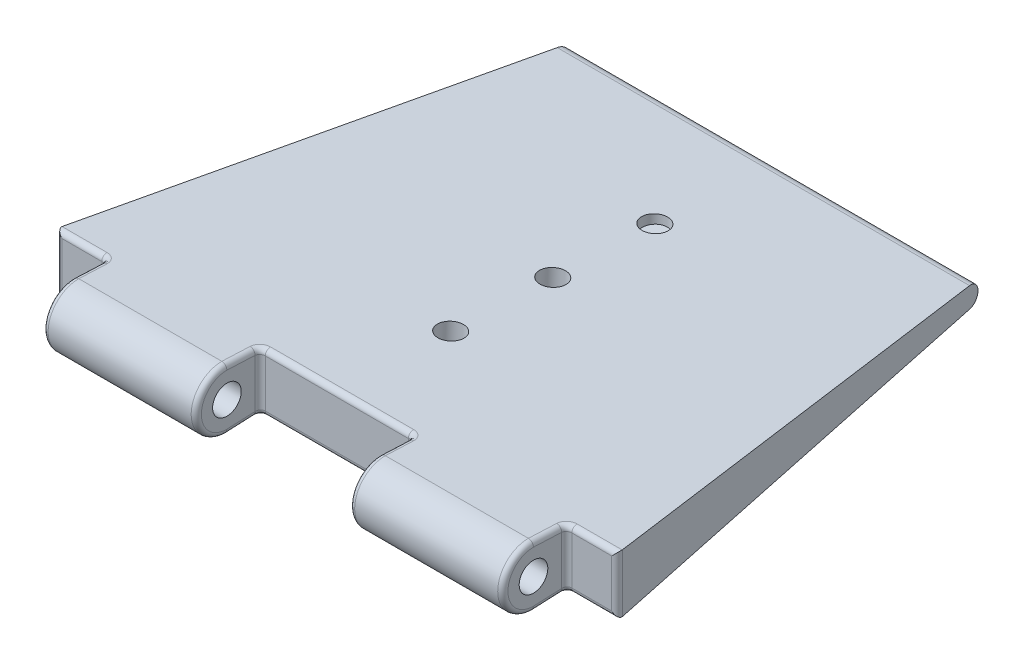
from build123d import *

# Parameters (mm, degrees)
SKETCH1_R                        = 1.4
BOSS_EXTRUDE1_DEPTH              = 55
CUT_EXTRUDE1_DEPTH               = 72.763500472
CUT_EXTRUDE1_DEPTH_BACK          = 72.763500472
SKETCH2_W                        = 15
SKETCH2_H                        = 6.5
CUT_EXTRUDE2_DEPTH               = 72.763500472
CUT_EXTRUDE2_DEPTH_BACK          = 72.763500472
FILLET3_R                        = 0.5
CUT_EXTRUDE3_REACH               = 75.793
CUT_EXTRUDE3_OFFSET_FROM_SURFACE = 2
SKETCH5_R                        = 1.25


with BuildPart() as part:
    # Sketch1 → Boss-Extrude1 (new body)
    with BuildSketch(Plane(origin=(0, 0, 0), x_dir=(0, 0, -1), z_dir=(1, 0, 0))):
        with BuildLine():
            Line((0.266140956, 2.988171513), (0, 3))
            ThreePointArc((0, 3), (-3, 0), (0, -3))
            Line((0, -3), (0.266140956, -2.988171513))
            Line((0.266140956, -2.988171513), (45, -1))
            ThreePointArc((45, -1), (46, 0), (45, 1))
            Line((45, 1), (0.266140956, 2.988171513))
        make_face()
        Circle(SKETCH1_R, mode=Mode.SUBTRACT)
    extrude(amount=BOSS_EXTRUDE1_DEPTH)

    # Sketch2 → Cut-Extrude1 (cut, two sides: drawn at the far end of the back side and taken through both)
    with BuildSketch(Plane(origin=(0, 0, 0), x_dir=(1, 0, 0), z_dir=(0, 1, 0)).offset(-CUT_EXTRUDE1_DEPTH_BACK)):
        with Locations((57.5, 0)):
            Rectangle(SKETCH2_W, SKETCH2_H)
        with Locations((27.5, 0)):
            Rectangle(SKETCH2_W, SKETCH2_H)
        with Locations((-2.5, 0)):
            Rectangle(SKETCH2_W, SKETCH2_H)
    extrude(amount=CUT_EXTRUDE1_DEPTH + CUT_EXTRUDE1_DEPTH_BACK, mode=Mode.SUBTRACT)

    # Sketch3 → Cut-Extrude2 (cut, two sides: drawn at the far end of the back side and taken through both)
    with BuildSketch(Plane(origin=(0, 0, 0), x_dir=(1, 0, 0), z_dir=(0, 1, 0)).offset(-CUT_EXTRUDE2_DEPTH_BACK)):
        Polygon((55, 3.25), (47.5, 46), (55, 46), align=None)
        Polygon((7.5, 46), (0, 46), (0, 3.25), align=None)
    extrude(amount=CUT_EXTRUDE2_DEPTH + CUT_EXTRUDE2_DEPTH_BACK, mode=Mode.SUBTRACT)

    # Fillet3
    fillet3_edges = [part.edges().sort_by_distance(p)[0] for p in [
        (50, -2.927777778, -1.625),
        (50, 2.927777778, -1.625),
        (5, 2.927777778, -1.625),
        (5, -2.927777778, -1.625),
        (20, -2.927777778, -1.625),
        (20, 2.927777778, -1.625),
        (35, 2.927777778, -1.625),
        (35, -2.927777778, -1.625),
        (50, 0, -3.25),
        (52.5, 2.855555556, -3.25),
        (55, 0, -3.25),
        (52.5, -2.855555556, -3.25),
        (0, 0, -3.25),
        (2.5, 2.855555556, -3.25),
        (5, 0, -3.25),
        (2.5, -2.855555556, -3.25),
        (20, 0, -3.25),
        (27.5, 2.855555556, -3.25),
        (35, 0, -3.25),
        (27.5, -2.855555556, -3.25),
        (5, 0, 3),
        (20, 0, 3),
        (35, 0, 3),
        (50, 0, 3),
    ]]
    fillet(fillet3_edges, radius=FILLET3_R)

    # Cut-Extrude3: up to this face of the body (flat: up to its plane, moved by the offset)
    cut_extrude3_end = Plane(part.part.faces().sort_by_distance((27.5, -2.01165646, -22.237729641))[0]).offset(-CUT_EXTRUDE3_OFFSET_FROM_SURFACE)
    # Sketch5 → Cut-Extrude3 (cut, up to the picked face)
    with BuildSketch(Plane(origin=(0, 2.994085757, -0.133070478), x_dir=(1, 0, 0), z_dir=(0, 0.9990138064662089, -0.0444006136207204)), mode=Mode.PRIVATE) as cut_extrude3_sk1:
        with Locations((27.5, 24.276971468)):
            Circle(SKETCH5_R)
    cut_extrude3_tool1 = split(extrude(cut_extrude3_sk1.sketch, amount=-CUT_EXTRUDE3_REACH, mode=Mode.PRIVATE), bisect_by=cut_extrude3_end, keep=Keep.BOTH, mode=Mode.PRIVATE)
    # Sketch5 → Cut-Extrude3 (cut, up to the picked face)
    with BuildSketch(Plane(origin=(0, 2.994085757, -0.133070478), x_dir=(1, 0, 0), z_dir=(0, 0.9990138064662089, -0.0444006136207204)), mode=Mode.PRIVATE) as cut_extrude3_sk2:
        with Locations((27.5, 14.276971468)):
            Circle(SKETCH5_R)
    cut_extrude3_tool2 = split(extrude(cut_extrude3_sk2.sketch, amount=-CUT_EXTRUDE3_REACH, mode=Mode.PRIVATE), bisect_by=cut_extrude3_end, keep=Keep.BOTH, mode=Mode.PRIVATE)
    # Sketch5 → Cut-Extrude3 (cut, up to the picked face)
    with BuildSketch(Plane(origin=(0, 2.994085757, -0.133070478), x_dir=(1, 0, 0), z_dir=(0, 0.9990138064662089, -0.0444006136207204)), mode=Mode.PRIVATE) as cut_extrude3_sk3:
        with Locations((27.5, 34.276971468)):
            Circle(SKETCH5_R)
    cut_extrude3_tool3 = split(extrude(cut_extrude3_sk3.sketch, amount=-CUT_EXTRUDE3_REACH, mode=Mode.PRIVATE), bisect_by=cut_extrude3_end, keep=Keep.BOTH, mode=Mode.PRIVATE)
    add(cut_extrude3_tool1.solids().sort_by(Axis((27.5, 1.916173, -24.3861), (0, -0.9990138064662089, 0.0444006136207204)))[0], mode=Mode.SUBTRACT)
    add(cut_extrude3_tool2.solids().sort_by(Axis((27.5, 2.360179, -14.395962), (0, -0.9990138064662089, 0.0444006136207204)))[0], mode=Mode.SUBTRACT)
    add(cut_extrude3_tool3.solids().sort_by(Axis((27.5, 1.472167, -34.376238), (0, -0.9990138064662089, 0.0444006136207204)))[0], mode=Mode.SUBTRACT)


solid = part.part
